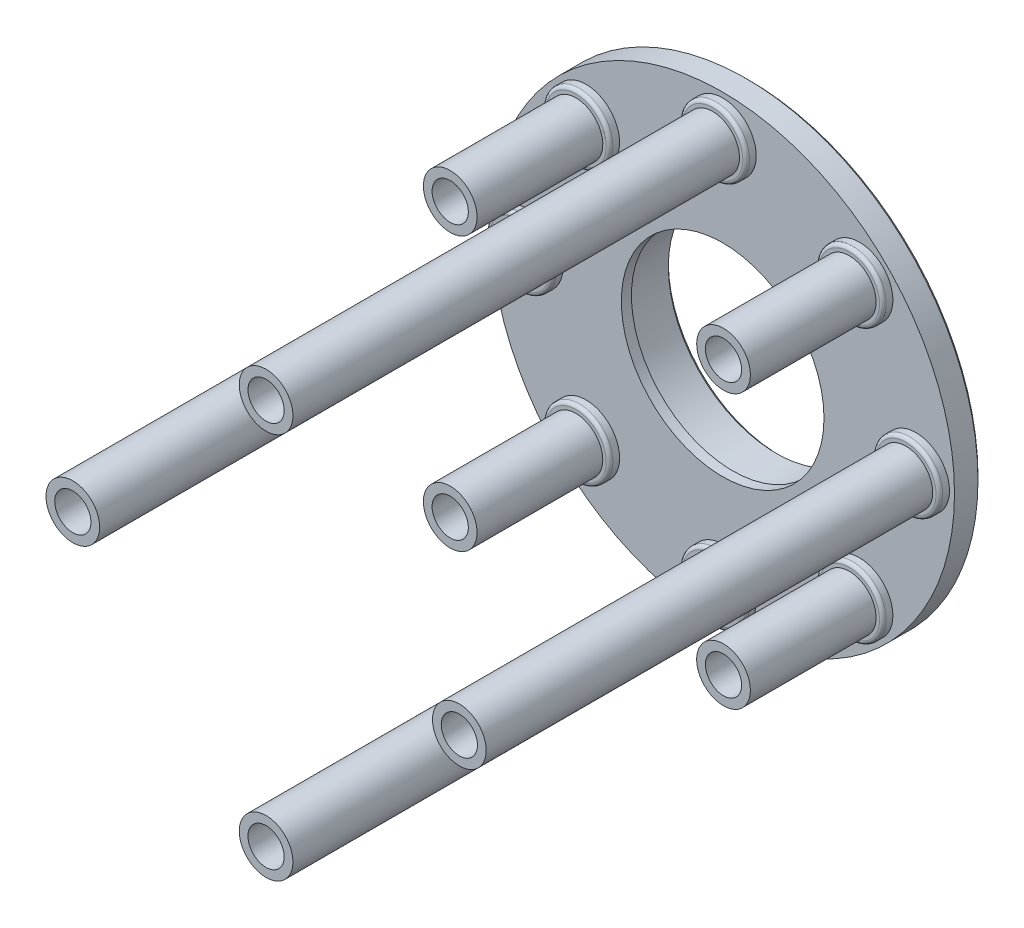
from build123d import *

# Parameters (mm, degrees)
SKETCH1_R                = 34.55
SKETCH1_R_2              = 2.7
BOSS_EXTRUDE1_DEPTH      = 4
SKETCH2_R                = 4
SKETCH2_R_2              = 2.7
BOSS_EXTRUDE2_DEPTH      = 68.04334183
SKETCH3_R                = 5
SKETCH3_R_2              = 4
BOSS_EXTRUDE3_DEPTH      = 1.5
FILLET2_R                = 0.5
CIRPATTERN1_COUNT        = 8
FILLET2_OF_CIRPATTERN1_R = 0.5
CHAMFER1_SIZE            = 0.5
SKETCH9_R                = 8
CUT_EXTRUDE4_DEPTH       = 84.76933429
BOSS_EXTRUDE7_START      = -6.5
SKETCH10_R               = 8
SKETCH10_R_2             = 6.5
BOSS_EXTRUDE7_DEPTH      = 6.5
CUT_EXTRUDE5_DEPTH       = 84.76933429
CUT_EXTRUDE5_DEPTH_BACK  = 84.76933429
SKETCH14_R               = 16.1
SKETCH15_R               = 16.1
SKETCH15_R_2             = 15.1
BOSS_EXTRUDE8_DEPTH      = 1.5
SKETCH16_R               = 18.1
SKETCH16_R_2             = 16.1
BOSS_EXTRUDE9_DEPTH      = 4.5
CHAMFER3_SIZE2           = 4.5
CHAMFER3_SIZE            = 2
CUT_EXTRUDE3_START       = -5
SKETCH7_R                = 4.45
CUT_EXTRUDE3_DEPTH       = 93.049687547
CIRPATTERN2_COUNT        = 8
CHAMFER4_SIZE            = 0.5
SKETCH17_R               = 6.596186261
CUT_EXTRUDE6_DEPTH       = 47.80441483
CIRPATTERN3_COUNT        = 4


with BuildPart() as part:
    # Sketch1 → Boss-Extrude1 (new body)
    with BuildSketch(Plane.XY):
        Circle(SKETCH1_R)
        with Locations((0, 28.8)):
            Circle(SKETCH1_R_2, mode=Mode.SUBTRACT)
        with Locations((28.8, 0)):
            Circle(SKETCH1_R_2, mode=Mode.SUBTRACT)
        with Locations((0, -28.8)):
            Circle(SKETCH1_R_2, mode=Mode.SUBTRACT)
        with Locations((-28.8, 0)):
            Circle(SKETCH1_R_2, mode=Mode.SUBTRACT)
    extrude(amount=BOSS_EXTRUDE1_DEPTH)

    # Sketch2 → Boss-Extrude2 (add)
    with BuildSketch(Plane.XY.offset(4)):
        with Locations((0, 28.8)):
            Circle(SKETCH2_R)
        with Locations((0, 28.8)):
            Circle(SKETCH2_R_2, mode=Mode.SUBTRACT)
    boss_extrude2 = extrude(amount=BOSS_EXTRUDE2_DEPTH)

    # Sketch3 → Boss-Extrude3 (add)
    with BuildSketch(Plane.XY.offset(4)):
        with Locations((0, 28.8)):
            Circle(SKETCH3_R)
        with Locations((0, 28.8)):
            Circle(SKETCH3_R_2, mode=Mode.SUBTRACT)
    boss_extrude3 = extrude(amount=BOSS_EXTRUDE3_DEPTH)

    # Fillet2
    fillet2_edges = [part.edges().sort_by_distance(p)[0] for p in [
        (-5, 28.8, 5.5),
    ]]
    fillet(fillet2_edges, radius=FILLET2_R)

    # CirPattern1: Boss-Extrude2, Boss-Extrude3 ×8 about axis
    cirpattern1_axis = Axis((0, 0, 0), (0, 0, 1))
    add([boss_extrude2.rotate(cirpattern1_axis, i * 360 / CIRPATTERN1_COUNT) for i in range(1, CIRPATTERN1_COUNT)])
    add([boss_extrude3.rotate(cirpattern1_axis, i * 360 / CIRPATTERN1_COUNT) for i in range(1, CIRPATTERN1_COUNT)])

    # Fillet2 of CirPattern1
    fillet2_of_cirpattern1_edges = [part.edges().sort_by_distance(p)[0] for p in [
        (-23.900209204, 16.829141392, 5.5),
        (-28.8, -5, 5.5),
        (-16.829141392, -23.900209204, 5.5),
        (5, -28.8, 5.5),
        (23.900209204, -16.829141392, 5.5),
        (28.8, 5, 5.5),
        (16.829141392, 23.900209204, 5.5),
    ]]
    fillet(fillet2_of_cirpattern1_edges, radius=FILLET2_OF_CIRPATTERN1_R)

    # Chamfer1
    chamfer1_edges = [part.edges().sort_by_distance(p)[0] for p in [
        (-34.55, 0, 0),
    ]]
    chamfer(chamfer1_edges, length=CHAMFER1_SIZE)

    # Sketch9 → Cut-Extrude4 (cut, through all)
    with BuildSketch(Plane.XY.offset(4)):
        Circle(SKETCH9_R)
    extrude(amount=-CUT_EXTRUDE4_DEPTH, mode=Mode.SUBTRACT)

    # Sketch10 → Boss-Extrude7 (add)
    with BuildSketch(Plane(origin=(0, 0, 0), x_dir=(-1, 0, 0), z_dir=(0, 0, -1)).offset(BOSS_EXTRUDE7_START)):
        Circle(SKETCH10_R)
        Circle(SKETCH10_R_2, mode=Mode.SUBTRACT)
    extrude(amount=BOSS_EXTRUDE7_DEPTH)

    # Sketch14 → Cut-Extrude5 (cut, two sides: drawn at the far end of the back side and taken through both)
    with BuildSketch(Plane.XY.offset(4).offset(-CUT_EXTRUDE5_DEPTH_BACK)):
        Circle(SKETCH14_R)
    extrude(amount=CUT_EXTRUDE5_DEPTH + CUT_EXTRUDE5_DEPTH_BACK, mode=Mode.SUBTRACT)

    # Sketch15 → Boss-Extrude8 (add)
    with BuildSketch(Plane.XY.offset(4)):
        Circle(SKETCH15_R)
        Circle(SKETCH15_R_2, mode=Mode.SUBTRACT)
    extrude(amount=-BOSS_EXTRUDE8_DEPTH)

    # Sketch16 → Boss-Extrude9 (add)
    with BuildSketch(Plane(origin=(0, 0, 0), x_dir=(-1, 0, 0), z_dir=(0, 0, -1))):
        with Locations(Location((0, 0, 0), (0, 0, 180))):
            Circle(SKETCH16_R)
        with Locations(Location((0, 0, 0), (0, 0, 180))):
            Circle(SKETCH16_R_2, mode=Mode.SUBTRACT)
    extrude(amount=BOSS_EXTRUDE9_DEPTH)

    # Chamfer3
    chamfer3_edges = [part.edges().sort_by_distance(p)[0] for p in [
        (-18.1, 0, 0),
    ]]
    chamfer3_side = [part.faces().sort_by_distance(p)[0] for p in [
        (-18.14, 0, 0),
    ]]
    chamfer(chamfer3_edges, length=CHAMFER3_SIZE - 0.0001, length2=CHAMFER3_SIZE2 - 0.0001, reference=chamfer3_side[0])  # a hair under: the kernel refuses the full size

    # Sketch7 → Cut-Extrude3 (cut)
    with BuildSketch(Plane(origin=(0, 0, 0), x_dir=(-1, 0, 0), z_dir=(0, 0, -1)).offset(CUT_EXTRUDE3_START)):
        with Locations(Location((0, 28.8, 0), (0, 0, 180))):
            Circle(SKETCH7_R)
    cut_extrude3 = extrude(amount=CUT_EXTRUDE3_DEPTH, mode=Mode.SUBTRACT)

    # CirPattern2: Cut-Extrude3 ×8 about axis
    cirpattern2_axis = Axis((0, 0, 0), (0, 0, 1))
    for i in range(1, CIRPATTERN2_COUNT):
        add(cut_extrude3.rotate(cirpattern2_axis, i * 360 / CIRPATTERN2_COUNT), mode=Mode.SUBTRACT)

    # Chamfer4
    chamfer4_edges = [part.edges().sort_by_distance(p)[0] for p in [
        (-16.1, 0, -4.5),
    ]]
    chamfer(chamfer4_edges, length=CHAMFER4_SIZE)

    # Sketch17 → Cut-Extrude6 (cut)
    with BuildSketch(Plane.XY.offset(72.04334183)):
        with Locations((-20.364675298, 20.364675298)):
            Circle(SKETCH17_R)
    cut_extrude6 = extrude(amount=-CUT_EXTRUDE6_DEPTH, mode=Mode.SUBTRACT)

    # CirPattern3: Cut-Extrude6 ×4 about axis
    cirpattern3_axis = Axis((0, 0, 4), (0, 0, 1))
    for i in range(1, CIRPATTERN3_COUNT):
        add(cut_extrude6.rotate(cirpattern3_axis, i * 360 / CIRPATTERN3_COUNT), mode=Mode.SUBTRACT)


solid = part.part
